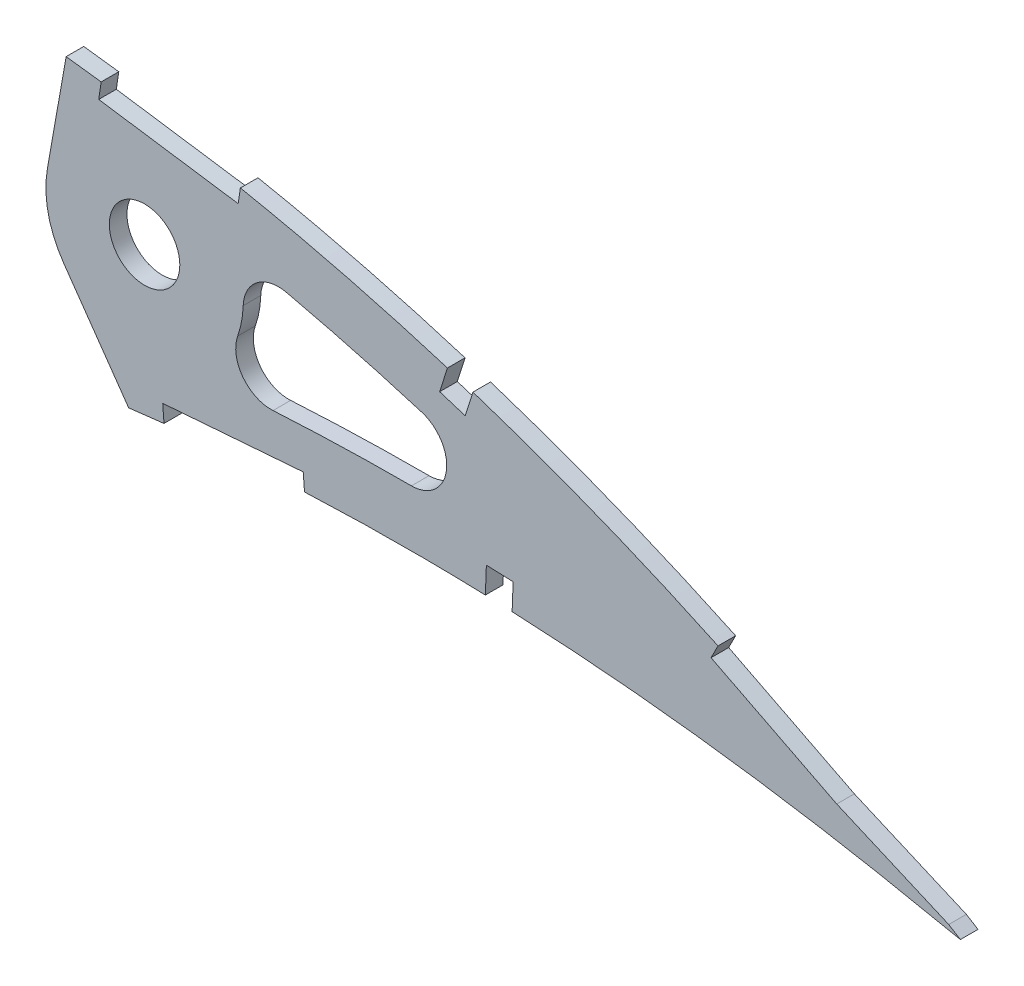
from build123d import *

# Parameters (mm, degrees)
BOSS_EXTRUDE1_DEPTH = 3.175
SKETCH4_R           = 6.35
CUT_EXTRUDE2_DEPTH  = 7.62
CUT_EXTRUDE3_DEPTH  = 7.62
FILLET1_R           = 6.35


with BuildPart() as part:
    # Sketch1 → Boss-Extrude1 (new body)
    with BuildSketch(Plane.XY):
        with BuildLine():
            Line((502.79773875, -0.784854231), (507.466663145, -1.71152324))
            Line((507.466663145, -1.71152324), (503.425622155, 0.784854231))
            add(Edge.make_bspline(
                [(503.425622155, 0.784854231), (503.387056523, 0.808678383), (503.232943706, 0.903882506), (502.885699565, 1.116877467), (502.307465731, 1.471631004), (501.497989026, 1.96567955), (500.45789772, 2.597710645), (499.186668738, 3.363298805), (497.685095824, 4.259956995), (495.953542232, 5.283444029), (493.992185329, 6.428967913), (491.80177187, 7.691887565), (489.382492784, 9.065053582), (486.735285081, 10.542854645), (483.861056965, 12.118262786), (480.760352067, 13.784162223), (477.434280878, 15.532079613), (473.88412009, 17.354496627), (470.110517029, 19.241349676), (466.11525081, 21.184786117), (461.8996524, 23.175115764), (457.465160771, 25.201720056), (452.814323541, 27.256337372), (447.948426531, 29.326194505), (442.870242622, 31.402323167), (437.581933839, 33.472908178), (432.086631293, 35.528519181), (426.386455038, 37.555839622), (420.485666169, 39.546009798), (414.38712726, 41.486101224), (408.095199476, 43.365577113), (401.613538504, 45.172251969), (394.947547526, 46.896860198), (388.101454206, 48.526842247), (381.081061063, 50.051288093), (373.891948514, 51.461019148), (366.540145776, 52.741961538), (359.04602551, 53.893116322), (351.530166329, 54.850682287), (344.029770472, 55.789835004), (336.540544467, 56.672083061), (328.959784459, 57.516957665), (321.294783559, 58.319701885), (313.553144836, 59.077805613), (305.74270558, 59.787996951), (297.871582303, 60.448193241), (289.947391455, 61.054653465), (281.978488624, 61.606443402), (273.972752071, 62.098711989), (265.938708914, 62.531089773), (257.884514812, 62.900561137), (249.818551509, 63.204580293), (241.749383842, 63.441312028), (233.685387885, 63.608488355), (225.6352949, 63.705058175), (217.607478242, 63.728382774), (209.610665097, 63.678044957), (201.65322943, 63.552316286), (193.743907339, 63.349475598), (185.891084219, 63.06914433), (178.103251674, 62.711444076), (170.388936599, 62.273379295), (162.75650763, 61.757741728), (155.21446412, 61.162365234), (147.771092618, 60.487091521), (140.434193858, 59.734735375), (133.21193631, 58.903250486), (126.112060053, 57.995002679), (119.142330926, 57.011772691), (112.310569153, 55.953024983), (105.624093076, 54.821817655), (99.090119317, 53.619308085), (92.715560781, 52.349021738), (86.507357689, 51.011289913), (80.472081741, 49.610125488), (74.616005172, 48.147969617), (68.945423127, 46.627499094), (63.466083945, 45.052362302), (58.183528407, 43.426132862), (53.103914735, 41.750597597), (48.231081995, 40.032109382), (43.57101596, 38.271888166), (39.127286386, 36.475356686), (34.905100975, 34.644967962), (30.907613889, 32.786301909), (27.139349344, 30.901474598), (23.602993011, 28.995766687), (20.302095112, 27.072100319), (17.239833127, 25.134048547), (14.417494091, 23.186527339), (11.838969232, 21.230759107), (9.505144331, 19.27168598), (7.417496279, 17.312291137), (5.579009223, 15.353924281), (3.9896169, 13.40003417), (2.651402342, 11.45216816), (1.564597701, 9.512169406), (0.731661122, 7.581447178), (0.1517667, 5.66108724), (-0.165663648, 3.753924021), (-0.244673978, 1.85842856), (-0.081436131, 0.618550581), (0, 0)],
                knots=[0, 0, 0, 0, 0.00025409, 0.001015373, 0.002283359, 0.004056577, 0.006330982, 0.009105275, 0.012374489, 0.016134023, 0.02037966, 0.025105976, 0.030306237, 0.035972206, 0.042099522, 0.048678064, 0.055701664, 0.063160184, 0.071045824, 0.079349826, 0.08806291, 0.097175757, 0.106678112, 0.116561573, 0.126814276, 0.1374283, 0.148393618, 0.15969976, 0.171338126, 0.183297699, 0.195569604, 0.208143556, 0.221011593, 0.234161831, 0.24758745, 0.261276822, 0.27522271, 0.289414144, 0.3037712, 0.317689227, 0.331784111, 0.346039677, 0.36044387, 0.374982721, 0.389640455, 0.404403317, 0.419256601, 0.434186749, 0.449177265, 0.464214782, 0.479284009, 0.49436974, 0.509457833, 0.524532346, 0.53957932, 0.554582984, 0.569529546, 0.584403417, 0.599190992, 0.613876838, 0.628447475, 0.642888675, 0.657186054, 0.671325546, 0.685294014, 0.699078147, 0.712665095, 0.726042645, 0.739197713, 0.752117586, 0.764792042, 0.777208152, 0.789355685, 0.80122396, 0.812803686, 0.824082909, 0.835054602, 0.845709571, 0.856037853, 0.866033834, 0.875688843, 0.884997719, 0.893953426, 0.902552897, 0.910789386, 0.918660734, 0.926166253, 0.933302626, 0.94007122, 0.94647478, 0.952517526, 0.958204819, 0.963546652, 0.9685566, 0.973249913, 0.977651041, 0.981787043, 0.985694226, 0.989415109, 0.993001157, 0.996508416, 1, 1, 1, 1], degree=3))
            add(Edge.make_bspline(
                [(0, 0), (0.129277918, -0.610277991), (0.388427893, -1.8336387), (1.09250455, -3.594771251), (2.023612315, -5.287729771), (3.201293003, -6.908017366), (4.61771618, -8.455191194), (6.269753486, -9.930860517), (8.155784822, -11.334231849), (10.273341647, -12.664666589), (12.619347944, -13.923576968), (15.191166787, -15.110180321), (17.986453192, -16.224105848), (21.002161638, -17.263864435), (24.234605302, -18.231039739), (27.680710983, -19.123274687), (31.336560086, -19.941816444), (35.198636392, -20.684575522), (39.262731423, -21.352306607), (43.524623173, -21.944635889), (47.97993709, -22.461933953), (52.624302184, -22.903115294), (57.453124717, -23.269128853), (62.461591735, -23.56021739), (67.644841608, -23.77730407), (72.997909324, -23.919563453), (78.51555217, -23.989213541), (84.19278374, -23.987299874), (90.024050352, -23.913310584), (96.004370725, -23.771333186), (102.128006069, -23.560468263), (108.38942798, -23.283267615), (114.782988575, -22.942520838), (121.302953529, -22.539383102), (127.943585047, -22.075641101), (134.699117226, -21.555013733), (141.563413308, -20.978799747), (148.530486699, -20.350357624), (155.594169408, -19.672833542), (162.748358534, -18.948371701), (169.986739237, -18.180380072), (177.302864412, -17.371347266), (184.690510287, -16.525589468), (192.142928282, -15.644636961), (199.653816553, -14.733519469), (207.21610926, -13.793977853), (214.823482798, -12.829630943), (222.469095066, -11.845019347), (230.145788458, -10.840030717), (237.847106351, -9.821825282), (245.565621831, -8.789564391), (253.29461644, -7.748557009), (261.026935583, -6.702038843), (268.755047845, -5.650332066), (276.472159998, -4.597795103), (284.171113039, -3.547317471), (291.844365725, -2.498995132), (299.484975802, -1.458038633), (307.085249349, -0.424320765), (314.63817827, 0.600062666), (322.136524598, 1.612053914), (329.5732141, 2.610375922), (336.940575301, 3.59439687), (344.231196069, 4.564486382), (351.328594574, 5.491199859), (358.214225209, 6.423884937), (364.911291302, 7.188480074), (371.524970385, 7.841089466), (378.062132498, 8.376139176), (384.514927939, 8.801326851), (390.8759632, 9.119690648), (397.137657243, 9.335675398), (403.292100638, 9.455688483), (409.331606334, 9.482775598), (415.247930621, 9.425574995), (421.03337879, 9.288697453), (426.679876255, 9.07828687), (432.179545635, 8.801442011), (437.52457516, 8.465709972), (442.70694032, 8.076042936), (447.719419769, 7.641538035), (452.554279933, 7.168555777), (457.204096822, 6.662500198), (461.662085653, 6.133975032), (465.921110964, 5.586460219), (469.974766574, 5.028953281), (473.816527145, 4.467104121), (477.440308359, 3.908085671), (480.840416637, 3.3572311), (484.011359843, 2.821851589), (486.948170814, 2.306949228), (489.645753402, 1.817552616), (492.100365244, 1.35983632), (494.307158383, 0.936074272), (496.26318146, 0.553249972), (497.964797452, 0.213052808), (499.40951194, -0.07972438), (500.594801875, -0.323926), (501.518867114, -0.515543372), (502.179882379, -0.654882666), (502.577132717, -0.73779659), (502.753636076, -0.775446656), (502.79773875, -0.784854231)],
                knots=[0, 0, 0, 0, 0.003638255, 0.007293231, 0.011028136, 0.014901081, 0.018963272, 0.023258475, 0.027820626, 0.032679082, 0.03785316, 0.043361875, 0.049214679, 0.055422346, 0.061988786, 0.068918036, 0.076211157, 0.083868392, 0.091887411, 0.100265912, 0.108999867, 0.118084529, 0.127514843, 0.13728527, 0.147387917, 0.157816481, 0.168563473, 0.179619128, 0.190977373, 0.202626974, 0.214560478, 0.226767249, 0.239236417, 0.251959004, 0.264923894, 0.278119703, 0.291536035, 0.30516028, 0.318980685, 0.332985499, 0.34716279, 0.361498603, 0.375980747, 0.390597192, 0.405332593, 0.420174823, 0.435109533, 0.450124276, 0.465203068, 0.480333154, 0.495500583, 0.510689775, 0.525887334, 0.541078314, 0.556247233, 0.571381784, 0.586466041, 0.601484516, 0.616424329, 0.631269422, 0.646006524, 0.660620684, 0.675098188, 0.689422858, 0.703581825, 0.716907564, 0.730009274, 0.742952128, 0.755725558, 0.768319952, 0.780724337, 0.792926529, 0.804916041, 0.816679084, 0.828203524, 0.8394749, 0.850481359, 0.861207697, 0.871639326, 0.881763414, 0.891563605, 0.901027364, 0.910138977, 0.918883976, 0.927249278, 0.935221104, 0.942784739, 0.949928188, 0.956638464, 0.962904203, 0.968712287, 0.974054485, 0.978918432, 0.983297219, 0.987180246, 0.990560674, 0.993433357, 0.995790625, 0.997629587, 0.998945816, 0.999736592, 1, 1, 1, 1], degree=3))
        make_face()
    extrude(amount=BOSS_EXTRUDE1_DEPTH)

    # Sketch4 → Cut-Extrude2 (cut)
    with BuildSketch(Plane.XY.offset(3.175)):
        with BuildLine():
            ThreePointArc((345.923037017, 23.034385848), (343.129017358, 29.38427855), (342.977678516, 36.320039485))
            Line((342.977678516, 36.320039485), (346.35876981, 55.495161072))
            add(Edge.make_bspline(
                [(346.35876981, 55.495161072), (345.592592424, 55.589836283), (342.330459329, 55.990017767), (336.540544467, 56.672083061), (328.959784459, 57.516957665), (321.294783559, 58.319701885), (313.553144836, 59.077805613), (305.74270558, 59.787996951), (297.871582303, 60.448193241), (289.947391455, 61.054653465), (281.978488624, 61.606443402), (273.972752071, 62.098711989), (265.938708914, 62.531089773), (257.884514812, 62.900561137), (249.818551509, 63.204580293), (241.749383842, 63.441312028), (233.685387885, 63.608488355), (225.6352949, 63.705058175), (217.607478242, 63.728382774), (209.610665097, 63.678044957), (201.65322943, 63.552316286), (193.743907339, 63.349475598), (185.891084219, 63.06914433), (178.103251674, 62.711444076), (170.388936599, 62.273379295), (162.75650763, 61.757741728), (155.21446412, 61.162365234), (147.771092618, 60.487091521), (140.434193858, 59.734735375), (133.21193631, 58.903250486), (126.112060053, 57.995002679), (119.142330926, 57.011772691), (112.310569153, 55.953024983), (105.624093076, 54.821817655), (99.090119317, 53.619308085), (92.715560781, 52.349021738), (86.507357689, 51.011289913), (80.472081741, 49.610125488), (74.616005172, 48.147969617), (68.945423127, 46.627499094), (63.466083945, 45.052362302), (58.183528407, 43.426132862), (53.103914735, 41.750597597), (48.231081995, 40.032109382), (43.57101596, 38.271888166), (39.127286386, 36.475356686), (34.905100975, 34.644967962), (30.907613889, 32.786301909), (27.139349344, 30.901474598), (23.602993011, 28.995766687), (20.302095112, 27.072100319), (17.239833127, 25.134048547), (14.417494091, 23.186527339), (11.838969232, 21.230759107), (9.505144331, 19.27168598), (7.417496279, 17.312291137), (5.579009223, 15.353924281), (3.9896169, 13.40003417), (2.651402342, 11.45216816), (1.564597701, 9.512169406), (0.731661122, 7.581447178), (0.1517667, 5.66108724), (-0.165663648, 3.753924021), (-0.244673978, 1.85842856), (-0.081436131, 0.618550581), (0, 0)],
                knots=[0.31336195, 0.31336195, 0.31336195, 0.31336195, 0.317689227, 0.331784111, 0.346039677, 0.36044387, 0.374982721, 0.389640455, 0.404403317, 0.419256601, 0.434186749, 0.449177265, 0.464214782, 0.479284009, 0.49436974, 0.509457833, 0.524532346, 0.53957932, 0.554582984, 0.569529546, 0.584403417, 0.599190992, 0.613876838, 0.628447475, 0.642888675, 0.657186054, 0.671325546, 0.685294014, 0.699078147, 0.712665095, 0.726042645, 0.739197713, 0.752117586, 0.764792042, 0.777208152, 0.789355685, 0.80122396, 0.812803686, 0.824082909, 0.835054602, 0.845709571, 0.856037853, 0.866033834, 0.875688843, 0.884997719, 0.893953426, 0.902552897, 0.910789386, 0.918660734, 0.926166253, 0.933302626, 0.94007122, 0.94647478, 0.952517526, 0.958204819, 0.963546652, 0.9685566, 0.973249913, 0.977651041, 0.981787043, 0.985694226, 0.989415109, 0.993001157, 0.996508416, 1, 1, 1, 1], degree=3))
            add(Edge.make_bspline(
                [(0, 0), (0.129277918, -0.610277991), (0.388427893, -1.8336387), (1.09250455, -3.594771251), (2.023612315, -5.287729771), (3.201293003, -6.908017366), (4.61771618, -8.455191194), (6.269753486, -9.930860517), (8.155784822, -11.334231849), (10.273341647, -12.664666589), (12.619347944, -13.923576968), (15.191166787, -15.110180321), (17.986453192, -16.224105848), (21.002161638, -17.263864435), (24.234605302, -18.231039739), (27.680710983, -19.123274687), (31.336560086, -19.941816444), (35.198636392, -20.684575522), (39.262731423, -21.352306607), (43.524623173, -21.944635889), (47.97993709, -22.461933953), (52.624302184, -22.903115294), (57.453124717, -23.269128853), (62.461591735, -23.56021739), (67.644841608, -23.77730407), (72.997909324, -23.919563453), (78.51555217, -23.989213541), (84.19278374, -23.987299874), (90.024050352, -23.913310584), (96.004370725, -23.771333186), (102.128006069, -23.560468263), (108.38942798, -23.283267615), (114.782988575, -22.942520838), (121.302953529, -22.539383102), (127.943585047, -22.075641101), (134.699117226, -21.555013733), (141.563413308, -20.978799747), (148.530486699, -20.350357624), (155.594169408, -19.672833542), (162.748358534, -18.948371701), (169.986739237, -18.180380072), (177.302864412, -17.371347266), (184.690510287, -16.525589468), (192.142928282, -15.644636961), (199.653816553, -14.733519469), (207.21610926, -13.793977853), (214.823482798, -12.829630943), (222.469095066, -11.845019347), (230.145788458, -10.840030717), (237.847106351, -9.821825282), (245.565621831, -8.789564391), (253.29461644, -7.748557009), (261.026935583, -6.702038843), (268.755047845, -5.650332066), (276.472159998, -4.597795103), (284.171113039, -3.547317471), (291.844365725, -2.498995132), (299.484975802, -1.458038633), (307.085249349, -0.424320765), (314.63817827, 0.600062666), (322.136524598, 1.612053914), (329.5732141, 2.610375922), (336.940575301, 3.59439687), (344.231196069, 4.564486382), (351.117851665, 5.463682975), (355.570236242, 6.065792972), (357.622644751, 6.325614382)],
                knots=[0, 0, 0, 0, 0.003638255, 0.007293231, 0.011028136, 0.014901081, 0.018963272, 0.023258475, 0.027820626, 0.032679082, 0.03785316, 0.043361875, 0.049214679, 0.055422346, 0.061988786, 0.068918036, 0.076211157, 0.083868392, 0.091887411, 0.100265912, 0.108999867, 0.118084529, 0.127514843, 0.13728527, 0.147387917, 0.157816481, 0.168563473, 0.179619128, 0.190977373, 0.202626974, 0.214560478, 0.226767249, 0.239236417, 0.251959004, 0.264923894, 0.278119703, 0.291536035, 0.30516028, 0.318980685, 0.332985499, 0.34716279, 0.361498603, 0.375980747, 0.390597192, 0.405332593, 0.420174823, 0.435109533, 0.450124276, 0.465203068, 0.480333154, 0.495500583, 0.510689775, 0.525887334, 0.541078314, 0.556247233, 0.571381784, 0.586466041, 0.601484516, 0.616424329, 0.631269422, 0.646006524, 0.660620684, 0.675098188, 0.689422858, 0.703581825, 0.715666119, 0.715666119, 0.715666119, 0.715666119], degree=3))
            Line((357.622644751, 6.325614382), (345.923037017, 23.034385848))
        make_face()
        with Locations((360.487560364, 33.232574886)):
            Circle(SKETCH4_R)
        with BuildLine():
            add(Edge.make_bspline(
                [(449.310029247, 17.688169663), (446.249039459, 19.020747171), (433.170756117, 24.506393863), (414.679058579, 31.031047018), (393.80463939, 36.815465198), (382.827401771, 39.31649937), (377.108884499, 40.466906028), (376.692008323, 40.549969666)],
                knots=[0.10567262, 0.10567262, 0.10567262, 0.10567262, 0.124896219, 0.187344328, 0.218568383, 0.249792437, 0.252246711, 0.252246711, 0.252246711, 0.252246711], degree=3))
            ThreePointArc((376.692008323, 40.549969666), (377.869209951, 36.975121833), (378.267560364, 33.232574886))
            ThreePointArc((378.267560364, 33.232574886), (375.881434835, 24.335551295), (369.363507634, 17.826538404))
            add(Edge.make_bspline(
                [(369.363507634, 17.826538404), (371.058927837, 17.984695414), (378.219642958, 18.60897736), (390.853329275, 19.378611039), (412.76643338, 19.853777151), (432.270770063, 19.143728063), (446.241905154, 17.975888205), (449.310029247, 17.688169663)],
                knots=[0.740513727, 0.740513727, 0.740513727, 0.740513727, 0.750216191, 0.781439167, 0.812662144, 0.875108096, 0.892707, 0.892707, 0.892707, 0.892707], degree=3))
        make_face()
    extrude(amount=-CUT_EXTRUDE2_DEPTH, mode=Mode.SUBTRACT)

    # Sketch5 → Cut-Extrude3 (cut)
    with BuildSketch(Plane.XY.offset(3.175)):
        Polygon((352.692050817, 54.890502964), (352.229394909, 51.749768196), (377.355273059, 48.048520932), (377.817928967, 51.1892557), align=None)
        Polygon((415.116140728, 41.458988723), (413.656945017, 36.860339024), (418.255594716, 35.401143313), (419.714790427, 39.999793012), align=None)
        Polygon((422.066041652, 14.009863458), (421.884586072, 9.188482963), (426.705966568, 9.007027383), (426.887422147, 13.828407878), align=None)
        Polygon((463.982164764, 22.630058453), (462.544778481, 19.79911738), (485.192307068, 8.300027116), (508.51024515, -1.771297252), (509.769160696, 1.143445009), (486.541107392, 11.175946957), align=None)
        Polygon((389.071727807, 12.053529198), (363.754487196, 10.095553464), (363.999234163, 6.930898388), (389.316474773, 8.888874122), align=None)
    extrude(amount=-CUT_EXTRUDE3_DEPTH, mode=Mode.SUBTRACT)

    # Fillet1
    fillet1_edges = [part.edges().sort_by_distance(p)[0] for p in [
        (449.310029247, 17.688169663, 1.5875),
        (369.363507634, 17.826538404, 1.5875),
        (376.692008323, 40.549969666, 1.5875),
    ]]
    fillet(fillet1_edges, radius=FILLET1_R)


solid = part.part
